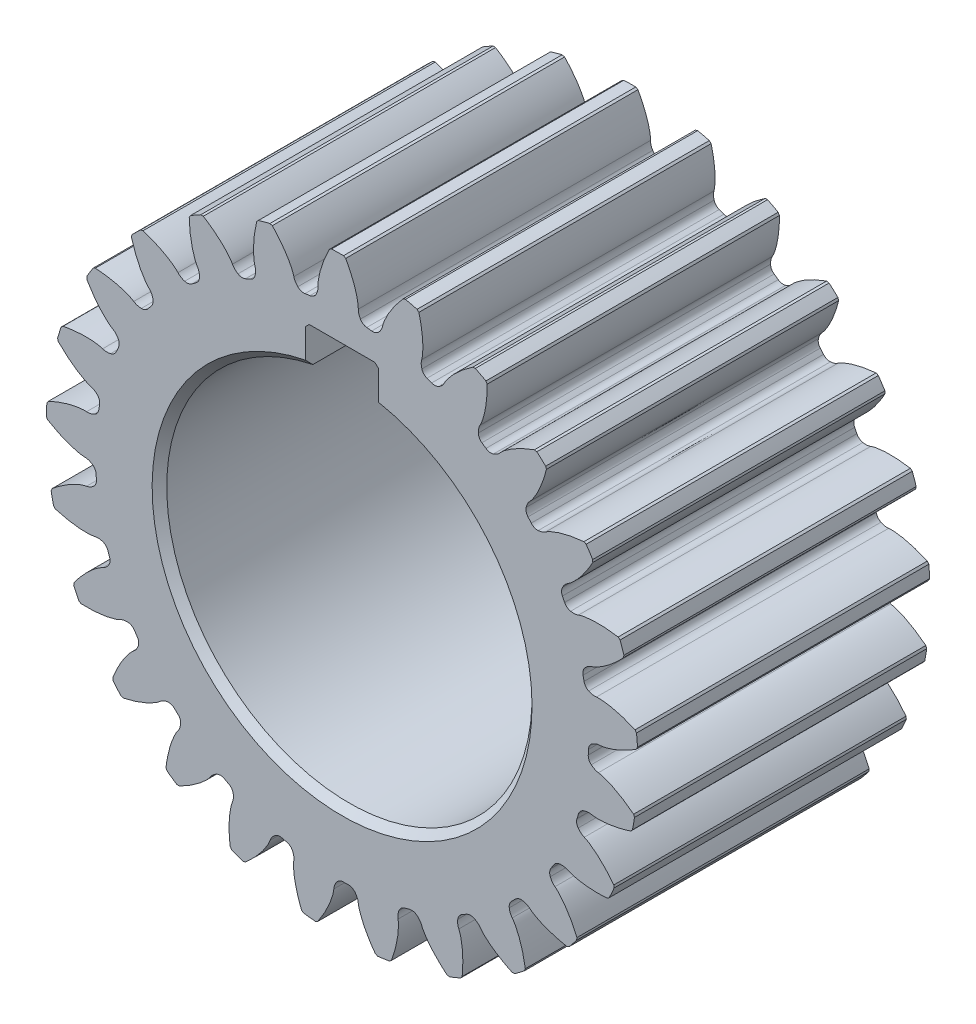
from build123d import *

# Parameters (mm, degrees)
SKETCH1_R                    = 33.75
BOSS_EXTRUDE1_DEPTH          = 40
CUT_EXTRUDE1_DEPTH           = 40
BOSS_EXTRUDE2_DEPTH          = 40
CHAMFER3_SIZE                = 0.5
CHAMFER4_SIZE                = 1.8
CHAMFER5_SIZE                = 1
CHAMFER6_SIZE                = 0.2
CIRPATTERN1_COUNT            = 25
CHAMFER6_OF_CIRPATTERN1_SIZE = 0.2


with BuildPart() as part:
    # Sketch1 → Boss-Extrude1 (new body)
    with BuildSketch(Plane.XY):
        Circle(SKETCH1_R)
    extrude(amount=BOSS_EXTRUDE1_DEPTH)

    # Sketch2 → Cut-Extrude1 (cut)
    with BuildSketch(Plane.XY.offset(40)):
        with BuildLine():
            Line((5, 24.494897428), (5, 30))
            Line((5, 30), (-5, 30))
            Line((-5, 30), (-5, 24.494897428))
            ThreePointArc((-5, 24.494897428), (0, -25), (5, 24.494897428))
        make_face()
    extrude(amount=-CUT_EXTRUDE1_DEPTH, mode=Mode.SUBTRACT)

    # Sketch3 → Boss-Extrude2 (add)
    with BuildSketch(Plane.XY):
        with BuildLine():
            ThreePointArc((33.726294519, -1.264736348), (33.647095062, 2.633532591), (33.118816509, 6.496652451))
            ThreePointArc((33.118816509, 6.496652451), (33.339712204, 6.013540097), (33.755550931, 5.682979046))
            add(Edge.make_bspline(
                [(34.815290708, 5.491820016), (34.307027836, 5.42571665), (33.755550931, 5.682979046)],
                knots=[0, 0, 0, 1, 1, 1], degree=2))
            add(Edge.make_bspline(
                [(34.815290708, 5.491820016), (34.824591829, 5.493029697), (34.850727422, 5.496056979), (34.900323154, 5.500335789), (34.981480485, 5.505262191), (35.085198434, 5.508515215), (35.219561574, 5.509242923), (35.378187894, 5.505625315), (35.552813009, 5.496958386), (35.743055515, 5.482464568), (35.933027136, 5.463525329), (36.122649687, 5.440463379), (36.311616952, 5.413729639), (36.540551081, 5.376904621), (36.815078717, 5.32657366), (37.135841111, 5.258758302), (37.49938905, 5.17124669), (37.869455826, 5.070746743), (38.233168964, 4.962566197), (38.599972378, 4.84261428), (38.954379847, 4.719009457), (39.321586911, 4.579754958), (39.660087385, 4.445684387), (39.969214709, 4.313058114), (40.1523355, 4.23292539), (40.260928631, 4.183969643), (40.284406198, 4.173322089)],
                knots=[0, 0, 0, 0, 0, 0.005376749, 0.015083688, 0.02853182, 0.04661014, 0.064854849, 0.092110526, 0.119476176, 0.146842496, 0.174208854, 0.201574956, 0.228941013, 0.256307345, 0.307035032, 0.361767352, 0.416499661, 0.471231937, 0.525964282, 0.580696616, 0.635428982, 0.690161387, 0.744893688, 0.799626082, 0.814455892, 0.814455892, 0.814455892, 0.814455892, 0.814455892], degree=4))
            ThreePointArc((40.284406198, 4.173322089), (40.376514059, 3.160239306), (40.4431487, 2.145162754))
            add(Edge.make_bspline(
                [(35.245772613, -0.008193768), (35.255148677, -0.007941599), (35.281437003, -0.006865699), (35.331094501, -0.003376031), (35.412030011, 0.004384455), (35.514991051, 0.017308046), (35.647831197, 0.037494144), (35.803962989, 0.06574764), (35.975113148, 0.101478148), (36.160783939, 0.145394426), (36.3454955, 0.193659845), (36.529220808, 0.24594346), (36.711727534, 0.301752199), (36.932144369, 0.37374759), (37.195498166, 0.466178139), (37.501803376, 0.583073622), (37.847308659, 0.726082314), (38.1972326, 0.882935409), (38.539685285, 1.04638704), (38.88335916, 1.221947497), (39.214219704, 1.399187749), (39.555289115, 1.593878532), (39.868808054, 1.778982188), (40.153536279, 1.95808912), (40.321959645, 2.06573696), (40.421613607, 2.130992075), (40.4431487, 2.145162754)],
                knots=[0, 0, 0, 0, 0, 0.005376749, 0.015083688, 0.02853182, 0.04661014, 0.064854849, 0.092110526, 0.119476176, 0.146842496, 0.174208854, 0.201574956, 0.228941013, 0.256307345, 0.307035032, 0.361767352, 0.416499661, 0.471231937, 0.525964282, 0.580696616, 0.635428982, 0.690161387, 0.744893688, 0.799626082, 0.814455912, 0.814455912, 0.814455912, 0.814455912, 0.814455912], degree=4))
            add(Edge.make_bspline(
                [(35.245772613, -0.008193768), (34.73341442, -0.021973638), (34.228679412, -0.361904939)],
                knots=[0, 0, 0, 1, 1, 1], degree=2))
            ThreePointArc((34.228679412, -0.361904939), (33.86933504, -0.753138982), (33.726294519, -1.264736348))
        make_face()
    boss_extrude2 = extrude(amount=BOSS_EXTRUDE2_DEPTH)

    # Chamfer3
    chamfer3_edges = [part.edges().sort_by_distance(p)[0] for p in [
        (-5, 30, 20),
        (5, 30, 20),
    ]]
    chamfer(chamfer3_edges, length=CHAMFER3_SIZE)

    # Chamfer4
    chamfer4_edges = [part.edges().sort_by_distance(p)[0] for p in [
        (0, -25, 0),
    ]]
    chamfer(chamfer4_edges, length=CHAMFER4_SIZE)

    # Chamfer5
    chamfer5_edges = [part.edges().sort_by_distance(p)[0] for p in [
        (0, -25, 40),
    ]]
    chamfer(chamfer5_edges, length=CHAMFER5_SIZE)

    # Chamfer6
    chamfer6_edges = [part.edges().sort_by_distance(p)[0] for p in [
        (40.4431487, 2.145162754, 20),
        (40.284406198, 4.173322089, 20),
    ]]
    chamfer(chamfer6_edges, length=CHAMFER6_SIZE - 0.0004)  # a hair under: the kernel refuses the full size

    # CirPattern1: Boss-Extrude2 ×25 about axis
    cirpattern1_axis = Axis((0, 0, 40), (0, 0, -1))
    for i in range(1, CIRPATTERN1_COUNT):
        add(boss_extrude2.rotate(cirpattern1_axis, i * 360 / CIRPATTERN1_COUNT))

    # Chamfer6 of CirPattern1
    chamfer6_of_cirpattern1_edges = [part.edges().sort_by_distance(p)[0] for p in [
        (39.706033097, -7.980033565, 20),
        (40.056660499, -5.976114931, 20),
        (36.474041406, -17.603815027, 20),
        (37.312007503, -15.750050671, 20),
        (30.950251551, -26.121484049, 20),
        (32.222903851, -24.534352802, 20),
        (23.481743565, -32.997844159, 20),
        (25.109116643, -31.777071316, 20),
        (14.53779127, -37.800828364, 20),
        (16.417631291, -37.023119571, 20),
        (4.680376084, -40.2286475, 20),
        (6.694565785, -39.942869063, 20),
        (-5.471124345, -40.128752764, 20),
        (-3.44914391, -40.352861191, 20),
        (-15.27885391, -37.507420908, 20),
        (-13.376131208, -38.227334643, 20),
        (-24.126556892, -32.529359854, 20),
        (-22.462646988, -33.699844069, 20),
        (-31.458299574, -25.507359486, 20),
        (-30.137752046, -27.054868354, 20),
        (-36.813401597, -16.882637911, 20),
        (-35.919191304, -18.709935758, 20),
        (-39.855382208, -7.197118107, 20),
        (-39.443695671, -9.189389089, 20),
        (-40.393102577, 2.940623097, 20),
        (-40.489807575, 0.908560693, 20),
        (-38.392775756, 12.893594137, 20),
        (-38.991795958, 10.949422266, 20),
        (-33.980089635, 22.036413238, 20),
        (-35.0437864, 20.302291368, 20),
        (-27.432309512, 29.794603452, 20),
        (-28.893846859, 28.379492837, 20),
        (-19.160856494, 35.680689153, 20),
        (-20.928400657, 34.673506398, 20),
        (-9.685456393, 39.32482593, 20),
        (-11.647946072, 38.788856032, 20),
        (0.398516553, 40.498039268, 20),
        (-1.635608197, 40.466959187, 20),
        (10.457449239, 39.126611857, 20),
        (8.479500956, 39.602374468, 20),
        (19.859301929, 35.296715526, 20),
        (18.061811879, 36.249426915, 20),
        (28.013321641, 29.248996745, 20),
        (26.509232735, 30.618794552, 20),
        (34.407161329, 21.363455929, 20),
        (33.290981004, 23.064270719, 20),
        (38.63907253, 12.135570608, 20),
        (37.9809345, 14.060533933, 20),
    ]]
    chamfer(chamfer6_of_cirpattern1_edges, length=CHAMFER6_OF_CIRPATTERN1_SIZE - 0.0004)  # a hair under: the kernel refuses the full size


solid = part.part
